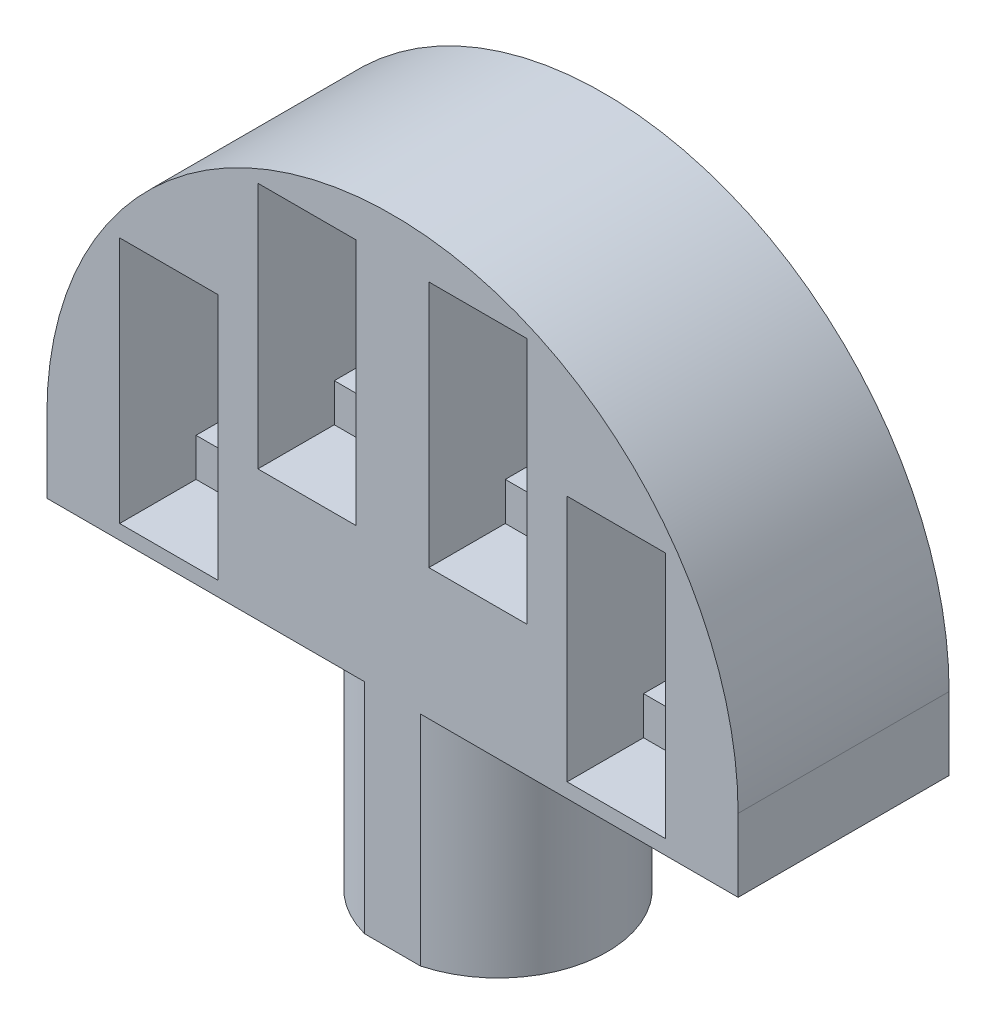
from build123d import *

# Parameters (mm, degrees)
BOSS_EXTRUDE1_DEPTH = 29
SKETCH2_W           = 13.5
SKETCH2_H           = 34
CUT_EXTRUDE1_DEPTH  = 10.5
SKETCH3_W           = 13.5
SKETCH3_H           = 23.5
CUT_EXTRUDE2_DEPTH  = 16.5
SKETCH4_R           = 2
BOSS_EXTRUDE2_DEPTH = 5
SKETCH5_R           = 15
BOSS_EXTRUDE3_DEPTH = 30
SKETCH6_W           = 13.5
SKETCH6_H           = 7
CUT_EXTRUDE3_DEPTH  = 76.176874769
CUT_SWEEP1_START    = 4.5
CUT_SWEEP1_DEPTH    = 7
CUT_SWEEP2_START    = 4.5
CUT_SWEEP2_DEPTH    = 7
SKETCH12_W          = 17.891050443
SKETCH12_H          = 2.835434375
SKETCH12_H_2        = 1.628785265
CUT_EXTRUDE4_DEPTH  = 81.204426371
SKETCH13_W          = 5
SKETCH13_H          = 2
CUT_EXTRUDE5_DEPTH  = 14
CUT_EXTRUDE6_REACH  = 72.532
SKETCH14_R          = 0.75


# Read off the part's stored shape, not the designer's step: Cut-Sweep1, Cut-Sweep2
with BuildPart() as part:
    # Sketch1 → Boss-Extrude1 (new body)
    with BuildSketch(Plane.XY):
        with BuildLine():
            Line((-47.5, 0), (-47.5, -10))
            Line((-47.5, -10), (47.5, -10))
            Line((47.5, -10), (47.5, 0))
            ThreePointArc((47.5, 0), (0, 47.5), (-47.5, 0))
        make_face()
    extrude(amount=BOSS_EXTRUDE1_DEPTH)

    # Sketch2 → Cut-Extrude1 (cut)
    with BuildSketch(Plane.XY.offset(29)):
        with Locations((-11.75, 25)):
            Rectangle(SKETCH2_W, SKETCH2_H)
        with Locations((-30.75, 9)):
            Rectangle(SKETCH2_W, SKETCH2_H)
        with Locations((11.75, 25)):
            Rectangle(SKETCH2_W, SKETCH2_H)
        with Locations((30.75, 9)):
            Rectangle(SKETCH2_W, SKETCH2_H)
    extrude(amount=-CUT_EXTRUDE1_DEPTH, mode=Mode.SUBTRACT)

    # Sketch3 → Cut-Extrude2 (cut)
    with BuildSketch(Plane.XY.offset(18.5)):
        with Locations((-30.75, 9)):
            Rectangle(SKETCH3_W, SKETCH3_H)
        with Locations((-11.75, 25)):
            Rectangle(SKETCH3_W, SKETCH3_H)
        with Locations((11.75, 25)):
            Rectangle(SKETCH3_W, SKETCH3_H)
        with Locations((30.75, 9)):
            Rectangle(SKETCH3_W, SKETCH3_H)
    extrude(amount=-CUT_EXTRUDE2_DEPTH, mode=Mode.SUBTRACT)

    # Sketch4 → Boss-Extrude2 (add)
    with BuildSketch(Plane.XY.offset(2)):
        with Locations((-30.75, 2.75)):
            Circle(SKETCH4_R)
        with Locations((-11.75, 18.75)):
            Circle(SKETCH4_R)
        with Locations((11.75, 18.75)):
            Circle(SKETCH4_R)
        with Locations((30.75, 2.75)):
            Circle(SKETCH4_R)
    extrude(amount=-BOSS_EXTRUDE2_DEPTH)

    # Sketch5 → Boss-Extrude3 (add)
    with BuildSketch(Plane.XZ.offset(10)):
        with Locations(Location((0, 14.5, 0), (0, 0, 75.164888418))):
            Circle(SKETCH5_R)
    extrude(amount=BOSS_EXTRUDE3_DEPTH)

    # Sketch6 → Cut-Extrude3 (cut, through all)
    with BuildSketch(Plane(origin=(0, -2.75, 0), x_dir=(1, 0, 0), z_dir=(0, 1, 0))):
        with Locations((-30.75, -8)):
            Rectangle(SKETCH6_W, SKETCH6_H)
        with Locations((30.75, -8)):
            Rectangle(SKETCH6_W, SKETCH6_H)
    extrude(amount=-CUT_EXTRUDE3_DEPTH, mode=Mode.SUBTRACT)

    # Cut-Sweep1 outline → Cut-Sweep1 (cut)
    with BuildSketch(Plane.XY.offset(CUT_SWEEP1_START)):
        with BuildLine():
            add(Edge.make_bspline(
                [(10.09293073, 0.865622012), (10.158507982, 0.8132547), (10.224085235, 0.760887388), (10.344761089, 0.664520587), (10.399859689, 0.620521098), (10.510056891, 0.53252212), (10.575782589, 0.480768017), (10.687361062, 0.389830057), (10.722006826, 0.358102491), (10.822573503, 0.270372805), (10.872459476, 0.226073686), (11.020907044, 0.091892503), (11.118258308, 0.000726476), (11.405323508, -0.27775049), (11.590048516, -0.470042532), (12.123088751, -1.065507013), (12.450244892, -1.487296275), (13.237414766, -2.664583794), (13.642325406, -3.456683186), (13.950694767, -4.286616898)],
                knots=[-0.06606621, -0.06606621, -0.06606621, -0.06606621, -0.041418484, -0.041418484, -0.020709242, -0.020709242, 0, 0, 0.03125, 0.03125, 0.0625, 0.0625, 0.125, 0.125, 0.25, 0.25, 0.5, 0.5, 0.914901294, 0.914901294, 0.914901294, 0.914901294], degree=3))
            add(Edge.make_bspline(
                [(13.950694767, -4.286616898), (13.956545087, -4.308413516), (13.962193517, -4.329572208), (13.997754147, -4.464404198), (14.020456863, -4.557187998), (14.071939242, -4.765799962), (14.097125947, -4.870238965), (14.171018968, -5.183938515), (14.218058149, -5.393581644), (14.352479491, -6.023907657), (14.433164685, -6.445987678), (14.648237063, -7.716725684), (14.755626633, -8.569885307), (14.842522061, -9.617254296), (14.856568462, -9.808593826), (14.868798899, -10.000049934)],
                knots=[-0.005254652, -0.005254652, -0.005254652, -0.005254652, 0, 0, 0.03125, 0.03125, 0.0625, 0.0625, 0.125, 0.125, 0.25, 0.25, 0.5, 0.5, 0.555826453, 0.555826453, 0.555826453, 0.555826453], degree=3))
            Line((14.868798899, -10.000049934), (24, -10))
            Line((24, -10), (24, 5.500112284))
            add(Edge.make_bspline(
                [(19.148927803, 10.891075343), (20.759922563, 9.557063313), (22.198078646, 8.022433211), (23.620658328, 6.058929699), (23.813192991, 5.781432037), (24, 5.500112284)],
                knots=[0.052213966, 0.052213966, 0.052213966, 0.052213966, 0.5, 0.5, 0.572452764, 0.572452764, 0.572452764, 0.572452764], degree=3))
            ThreePointArc((19.148927803, 10.891075343), (18.581175188, 12.003619671), (18.5, 13.25))
            Line((18.5, 13.25), (5, 13.25))
            add(Edge.make_bspline(
                [(5, 13.25), (4.940891554, 10.954259124), (5.362699935, 8.6714822), (6.651823557, 5.51182542), (7.190202986, 4.503055261), (8.146159858, 3.08598941), (8.489503453, 2.62960904), (9.039577732, 1.972262048), (9.228779106, 1.757680489), (9.521107555, 1.442991168), (9.619971538, 1.339291732), (9.770370583, 1.185584497), (9.820854118, 1.13465573), (9.92251757, 1.033419795), (9.984454015, 0.973203214), (10.054715512, 0.904124186), (10.074437349, 0.884349589), (10.09293073, 0.865622012)],
                knots=[0, 0, 0, 0, 0.5, 0.5, 0.75, 0.75, 0.875, 0.875, 0.9375, 0.9375, 0.96875, 0.96875, 0.984375, 0.984375, 1, 1, 1.011303011, 1.011303011, 1.011303011, 1.011303011], degree=3))
        make_face()
    extrude(amount=CUT_SWEEP1_DEPTH, mode=Mode.SUBTRACT)

    # Cut-Sweep2 outline → Cut-Sweep2 (cut)
    with BuildSketch(Plane.XY.offset(CUT_SWEEP2_START)):
        with BuildLine():
            add(Edge.make_bspline(
                [(-13.950694364, -4.286613385), (-13.956545087, -4.308413516), (-13.962193517, -4.329572208), (-13.997754147, -4.464404198), (-14.020456863, -4.557187998), (-14.071939242, -4.765799962), (-14.097125947, -4.870238965), (-14.171018968, -5.183938515), (-14.218058149, -5.393581644), (-14.352479491, -6.023907657), (-14.433164685, -6.445987678), (-14.648237063, -7.716725684), (-14.755626633, -8.569885307), (-14.842522061, -9.617254296), (-14.856568462, -9.808593826), (-14.868798899, -10.000049934)],
                knots=[-0.005254652, -0.005254652, -0.005254652, -0.005254652, 0, 0, 0.03125, 0.03125, 0.0625, 0.0625, 0.125, 0.125, 0.25, 0.25, 0.5, 0.5, 0.555826453, 0.555826453, 0.555826453, 0.555826453], degree=3))
            add(Edge.make_bspline(
                [(-10.09293073, 0.865622012), (-10.158507982, 0.8132547), (-10.224085235, 0.760887388), (-10.344761089, 0.664520587), (-10.399859689, 0.620521098), (-10.510056891, 0.53252212), (-10.575782589, 0.480768017), (-10.687361062, 0.389830057), (-10.722006826, 0.358102491), (-10.822573503, 0.270372805), (-10.872459476, 0.226073686), (-11.020907044, 0.091892503), (-11.118258308, 0.000726476), (-11.405323508, -0.27775049), (-11.590048516, -0.470042532), (-12.123088751, -1.065507013), (-12.450244892, -1.487296275), (-13.237414766, -2.664583794), (-13.642325406, -3.456683186), (-13.950694364, -4.286613385)],
                knots=[-0.06606621, -0.06606621, -0.06606621, -0.06606621, -0.041418484, -0.041418484, -0.020709242, -0.020709242, 0, 0, 0.03125, 0.03125, 0.0625, 0.0625, 0.125, 0.125, 0.25, 0.25, 0.5, 0.5, 0.914901294, 0.914901294, 0.914901294, 0.914901294], degree=3))
            add(Edge.make_bspline(
                [(-5, 13.25), (-4.940891554, 10.954259124), (-5.362699935, 8.6714822), (-6.651823557, 5.51182542), (-7.190202986, 4.503055261), (-8.146159858, 3.08598941), (-8.489503453, 2.62960904), (-9.039577732, 1.972262048), (-9.228779106, 1.757680489), (-9.521107555, 1.442991168), (-9.619971538, 1.339291732), (-9.770370583, 1.185584497), (-9.820854118, 1.13465573), (-9.92251757, 1.033419795), (-9.984454015, 0.973203214), (-10.054715513, 0.904124186), (-10.074437349, 0.884349589), (-10.09293073, 0.865622012)],
                knots=[0, 0, 0, 0, 0.5, 0.5, 0.75, 0.75, 0.875, 0.875, 0.9375, 0.9375, 0.96875, 0.96875, 0.984375, 0.984375, 1, 1, 1.011303011, 1.011303011, 1.011303011, 1.011303011], degree=3))
            Line((-5, 13.25), (-18.5, 13.25))
            ThreePointArc((-18.5, 13.25), (-18.581175188, 12.003619671), (-19.148916427, 10.891089572))
            add(Edge.make_bspline(
                [(-19.148916427, 10.891089572), (-20.759922563, 9.557063313), (-22.198078646, 8.022433211), (-23.620658328, 6.058929699), (-23.813192991, 5.781432037), (-24, 5.500112284)],
                knots=[0.052213966, 0.052213966, 0.052213966, 0.052213966, 0.5, 0.5, 0.572452764, 0.572452764, 0.572452764, 0.572452764], degree=3))
            Line((-24, 5.500112284), (-24, -10))
            Line((-24, -10), (-14.868798899, -10.000049934))
        make_face()
    extrude(amount=CUT_SWEEP2_DEPTH, mode=Mode.SUBTRACT)

    # Sketch12 → Cut-Extrude4 (cut, through all)
    with BuildSketch(Plane.XZ.offset(10)):
        with Locations((0.127592698, 30.417717188)):
            Rectangle(SKETCH12_W, SKETCH12_H)
        with Locations((0.127592698, -0.814392633)):
            Rectangle(SKETCH12_W, SKETCH12_H_2)
    extrude(amount=CUT_EXTRUDE4_DEPTH, mode=Mode.SUBTRACT)

    # Sketch13 → Cut-Extrude5 (cut)
    with BuildSketch(Plane.XY.offset(18.5)):
        with Locations((-30.75, -3.75)):
            Rectangle(SKETCH13_W, SKETCH13_H)
        with Locations((-11.75, 12.25)):
            Rectangle(SKETCH13_W, SKETCH13_H)
        with Locations((11.75, 12.25)):
            Rectangle(SKETCH13_W, SKETCH13_H)
        with Locations((30.75, -3.75)):
            Rectangle(SKETCH13_W, SKETCH13_H)
    extrude(amount=-CUT_EXTRUDE5_DEPTH, mode=Mode.SUBTRACT)

    # Cut-Extrude6: up to this face of the body (flat: up to its plane)
    cut_extrude6_end = Plane(part.part.faces().sort_by_distance((-19.543786762, 0.56058258, 4.5))[0])
    # Sketch14 → Cut-Extrude6 (cut, up to the picked face)
    with BuildSketch(Plane.XY.offset(18.5), mode=Mode.PRIVATE) as cut_extrude6_sk1:
        with Locations((-30.75, 23.25)):
            Circle(SKETCH14_R)
    cut_extrude6_tool1 = split(extrude(cut_extrude6_sk1.sketch, amount=-CUT_EXTRUDE6_REACH, mode=Mode.PRIVATE), bisect_by=cut_extrude6_end, keep=Keep.BOTH, mode=Mode.PRIVATE)
    # Sketch14 → Cut-Extrude6 (cut, up to the picked face)
    with BuildSketch(Plane.XY.offset(18.5), mode=Mode.PRIVATE) as cut_extrude6_sk2:
        with Locations((-11.75, 39.25)):
            Circle(SKETCH14_R)
    cut_extrude6_tool2 = split(extrude(cut_extrude6_sk2.sketch, amount=-CUT_EXTRUDE6_REACH, mode=Mode.PRIVATE), bisect_by=cut_extrude6_end, keep=Keep.BOTH, mode=Mode.PRIVATE)
    # Sketch14 → Cut-Extrude6 (cut, up to the picked face)
    with BuildSketch(Plane.XY.offset(18.5), mode=Mode.PRIVATE) as cut_extrude6_sk3:
        with Locations((11.75, 39.25)):
            Circle(SKETCH14_R)
    cut_extrude6_tool3 = split(extrude(cut_extrude6_sk3.sketch, amount=-CUT_EXTRUDE6_REACH, mode=Mode.PRIVATE), bisect_by=cut_extrude6_end, keep=Keep.BOTH, mode=Mode.PRIVATE)
    # Sketch14 → Cut-Extrude6 (cut, up to the picked face)
    with BuildSketch(Plane.XY.offset(18.5), mode=Mode.PRIVATE) as cut_extrude6_sk4:
        with Locations((30.75, 23.25)):
            Circle(SKETCH14_R)
    cut_extrude6_tool4 = split(extrude(cut_extrude6_sk4.sketch, amount=-CUT_EXTRUDE6_REACH, mode=Mode.PRIVATE), bisect_by=cut_extrude6_end, keep=Keep.BOTH, mode=Mode.PRIVATE)
    # Sketch14 → Cut-Extrude6 (cut, up to the picked face)
    with BuildSketch(Plane.XY.offset(18.5), mode=Mode.PRIVATE) as cut_extrude6_sk5:
        with Locations((30.75, -5.25)):
            Circle(SKETCH14_R)
    cut_extrude6_tool5 = split(extrude(cut_extrude6_sk5.sketch, amount=-CUT_EXTRUDE6_REACH, mode=Mode.PRIVATE), bisect_by=cut_extrude6_end, keep=Keep.BOTH, mode=Mode.PRIVATE)
    # Sketch14 → Cut-Extrude6 (cut, up to the picked face)
    with BuildSketch(Plane.XY.offset(18.5), mode=Mode.PRIVATE) as cut_extrude6_sk6:
        with Locations((11.75, 10.75)):
            Circle(SKETCH14_R)
    cut_extrude6_tool6 = split(extrude(cut_extrude6_sk6.sketch, amount=-CUT_EXTRUDE6_REACH, mode=Mode.PRIVATE), bisect_by=cut_extrude6_end, keep=Keep.BOTH, mode=Mode.PRIVATE)
    # Sketch14 → Cut-Extrude6 (cut, up to the picked face)
    with BuildSketch(Plane.XY.offset(18.5), mode=Mode.PRIVATE) as cut_extrude6_sk7:
        with Locations((-11.75, 10.75)):
            Circle(SKETCH14_R)
    cut_extrude6_tool7 = split(extrude(cut_extrude6_sk7.sketch, amount=-CUT_EXTRUDE6_REACH, mode=Mode.PRIVATE), bisect_by=cut_extrude6_end, keep=Keep.BOTH, mode=Mode.PRIVATE)
    # Sketch14 → Cut-Extrude6 (cut, up to the picked face)
    with BuildSketch(Plane.XY.offset(18.5), mode=Mode.PRIVATE) as cut_extrude6_sk8:
        with Locations((-30.75, -5.25)):
            Circle(SKETCH14_R)
    cut_extrude6_tool8 = split(extrude(cut_extrude6_sk8.sketch, amount=-CUT_EXTRUDE6_REACH, mode=Mode.PRIVATE), bisect_by=cut_extrude6_end, keep=Keep.BOTH, mode=Mode.PRIVATE)
    add(cut_extrude6_tool1.solids().sort_by(Axis((-30.75, 23.25, 18.5), (0, 0, -1)))[0], mode=Mode.SUBTRACT)
    add(cut_extrude6_tool2.solids().sort_by(Axis((-11.75, 39.25, 18.5), (0, 0, -1)))[0], mode=Mode.SUBTRACT)
    add(cut_extrude6_tool3.solids().sort_by(Axis((11.75, 39.25, 18.5), (0, 0, -1)))[0], mode=Mode.SUBTRACT)
    add(cut_extrude6_tool4.solids().sort_by(Axis((30.75, 23.25, 18.5), (0, 0, -1)))[0], mode=Mode.SUBTRACT)
    add(cut_extrude6_tool5.solids().sort_by(Axis((30.75, -5.25, 18.5), (0, 0, -1)))[0], mode=Mode.SUBTRACT)
    add(cut_extrude6_tool6.solids().sort_by(Axis((11.75, 10.75, 18.5), (0, 0, -1)))[0], mode=Mode.SUBTRACT)
    add(cut_extrude6_tool7.solids().sort_by(Axis((-11.75, 10.75, 18.5), (0, 0, -1)))[0], mode=Mode.SUBTRACT)
    add(cut_extrude6_tool8.solids().sort_by(Axis((-30.75, -5.25, 18.5), (0, 0, -1)))[0], mode=Mode.SUBTRACT)


solid = part.part
